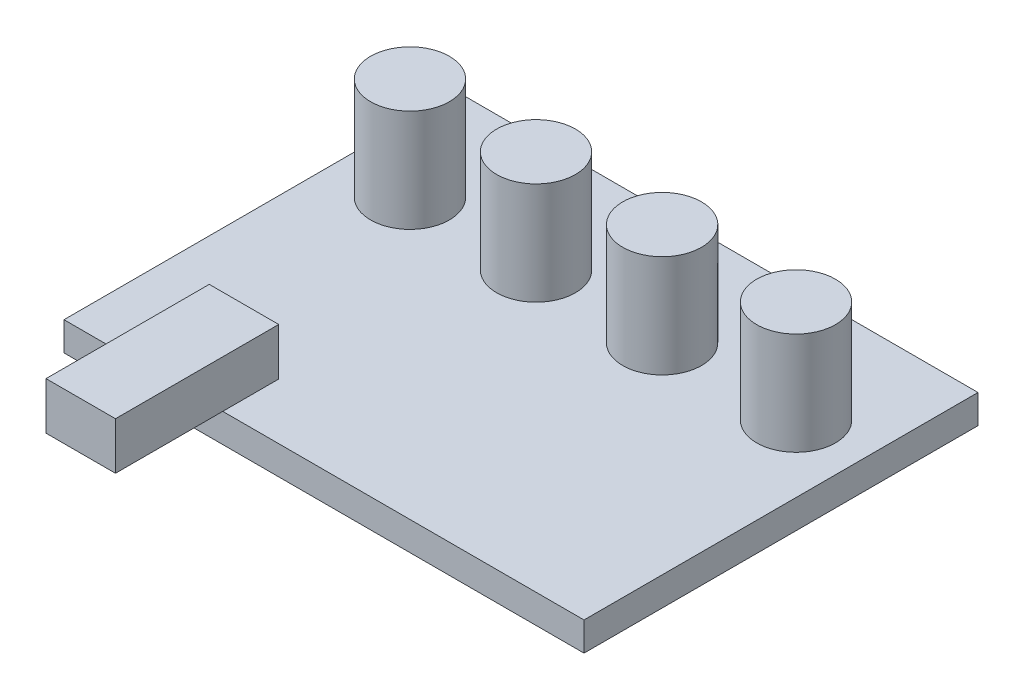
from build123d import *

# Parameters (mm, degrees)
SKETCH1_W           = 65.997826612
SKETCH1_H           = 50
BOSS_EXTRUDE1_DEPTH = 3.65
SKETCH2_R           = 5
BOSS_EXTRUDE2_DEPTH = 13
SKETCH3_W           = 8.816306995
SKETCH3_H           = 20.718287769
BOSS_EXTRUDE3_DEPTH = 6


with BuildPart() as part:
    # Sketch1 → Boss-Extrude1 (new body)
    with BuildSketch(Plane(origin=(0, 0, 0), x_dir=(1, 0, 0), z_dir=(0, 1, 0))):
        with Locations((0, -0.7)):
            Rectangle(SKETCH1_W, SKETCH1_H)
    extrude(amount=BOSS_EXTRUDE1_DEPTH)

    # Sketch2 → Boss-Extrude2 (add)
    with BuildSketch(Plane(origin=(0, 3.65, 0), x_dir=(1, 0, 0), z_dir=(0, 1, 0))):
        with Locations((-24.5, 9.711573264)):
            Circle(SKETCH2_R)
        with Locations((-8.5, 9.711573264)):
            Circle(SKETCH2_R)
        with Locations((7.5, 9.711573264)):
            Circle(SKETCH2_R)
        with Locations((24.5, 9.711573264)):
            Circle(SKETCH2_R)
    extrude(amount=BOSS_EXTRUDE2_DEPTH)

    # Sketch3 → Boss-Extrude3 (add)
    with BuildSketch(Plane(origin=(0, 3.65, 0), x_dir=(1, 0, 0), z_dir=(0, 1, 0))):
        with Locations((-17.257821891, -28.955694161)):
            Rectangle(SKETCH3_W, SKETCH3_H)
    extrude(amount=BOSS_EXTRUDE3_DEPTH)


solid = part.part
